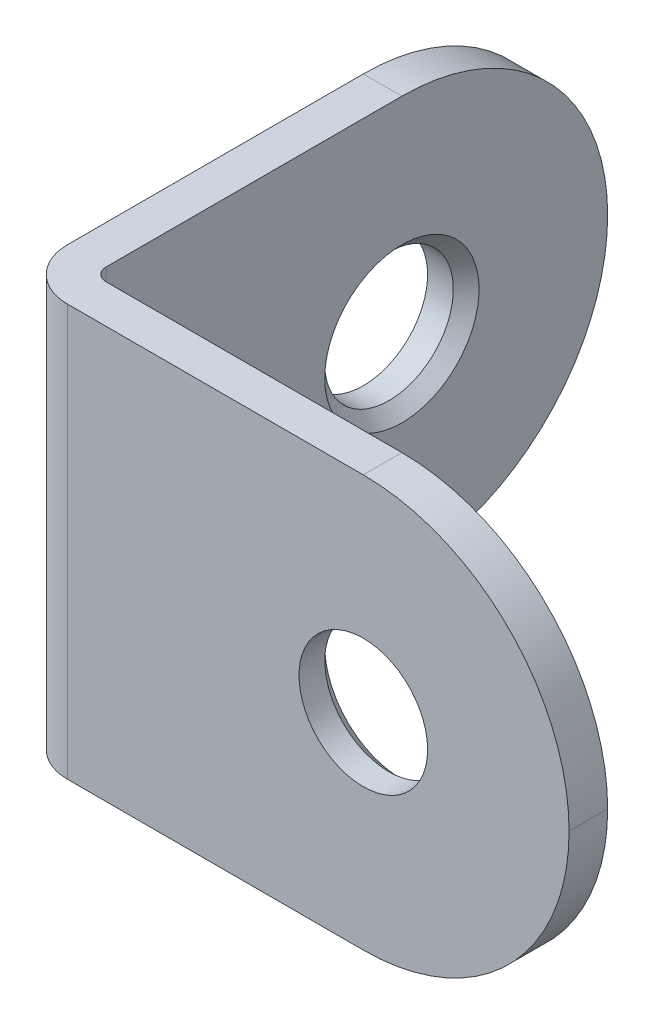
from build123d import *

# Parameters (mm, degrees)
EXTRUDE_1_DEPTH     = 16
FILLET_1_R          = 8
SKETCH_2_R          = 2.5
CUT_EXTRUDE_1_DEPTH = 16
SKETCH_3_R          = 2.5
CUT_EXTRUDE_2_DEPTH = 16
FILLET_3_R          = 2
FILLET_4_R          = 0.5
CHAMFER_1_SIZE      = 0.5


with BuildPart() as part:
    # Эскиз1 → Бобышка-Вытянуть1 (new body)
    with BuildSketch(Plane(origin=(0, 0, 0), x_dir=(1, 0, 0), z_dir=(0, 1, 0))):
        Polygon((0, 20), (0, 0), (20, 0), (20, -1.5), (-1.5, -1.5), (-1.5, 20), align=None)
    extrude(amount=EXTRUDE_1_DEPTH)

    # Скругление1
    fillet_1_edges = [part.edges().sort_by_distance(p)[0] for p in [
        (-0.75, 0, -20),
        (-0.75, 16, -20),
        (20, 0, 0.75),
        (20, 16, 0.75),
    ]]
    fillet(fillet_1_edges, radius=FILLET_1_R - 0.0001)  # a hair under: the kernel refuses the full size

    # Эскиз2 → Вырез-Вытянуть1 (cut)
    with BuildSketch(Plane.XY.offset(1.5)):
        with Locations((12, 8)):
            Circle(SKETCH_2_R)
    extrude(amount=-CUT_EXTRUDE_1_DEPTH, mode=Mode.SUBTRACT)

    # Эскиз3 → Вырез-Вытянуть2 (cut)
    with BuildSketch(Plane.ZY.offset(1.5)):
        with Locations((-12, 8)):
            Circle(SKETCH_3_R)
    extrude(amount=-CUT_EXTRUDE_2_DEPTH, mode=Mode.SUBTRACT)

    # Скругление3
    fillet_3_edges = [part.edges().sort_by_distance(p)[0] for p in [
        (-1.5, 8, 1.5),
    ]]
    fillet(fillet_3_edges, radius=FILLET_3_R)

    # Скругление4
    fillet_4_edges = [part.edges().sort_by_distance(p)[0] for p in [
        (0, 8, 0),
    ]]
    fillet(fillet_4_edges, radius=FILLET_4_R)

    # Фаска1
    chamfer_1_edges = [part.edges().sort_by_distance(p)[0] for p in [
        (9.5, 8, 0),
        (0, 8, -14.5),
    ]]
    chamfer(chamfer_1_edges, length=CHAMFER_1_SIZE)


solid = part.part
